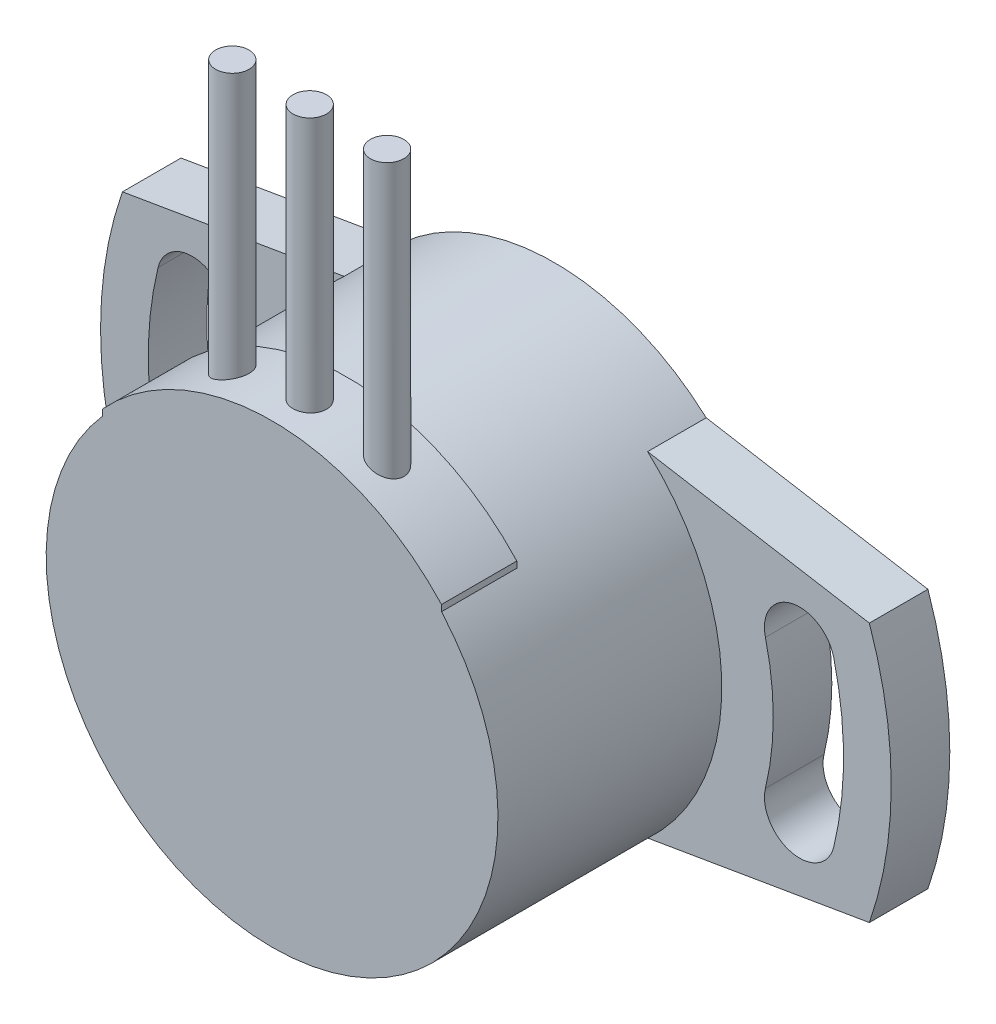
from build123d import *

# Parameters (mm, degrees)
SKETCH1_R           = 13.716
BOSS_EXTRUDE1_DEPTH = 13.589
BOSS_EXTRUDE2_START = 3.556
BOSS_EXTRUDE2_DEPTH = 3.556
CUT_EXTRUDE1_DEPTH  = 3.556
SKETCH4_R           = 4.953
BOSS_EXTRUDE3_DEPTH = 4.826
SKETCH5_R           = 3.01625
CUT_EXTRUDE2_DEPTH  = 2.54
BOSS_EXTRUDE4_DEPTH = 4.572
SKETCH6_R           = 1.016
BOSS_EXTRUDE5_DEPTH = 29.464


with BuildPart() as part:
    # Sketch1 → Boss-Extrude1 (new body)
    with BuildSketch(Plane.XY):
        Circle(SKETCH1_R)
    extrude(amount=BOSS_EXTRUDE1_DEPTH)

    # Sketch2 → Boss-Extrude2 (add)
    with BuildSketch(Plane(origin=(0, 0, 0), x_dir=(-1, 0, 0), z_dir=(0, 0, -1)).offset(BOSS_EXTRUDE2_START)):
        with BuildLine():
            Line((-9.214285431, 10.16), (-22.674746592, 7.874))
            ThreePointArc((-22.674746592, 7.874), (-24.003, 0), (-22.674746592, -7.874))
            Line((-22.674746592, -7.874), (-9.214285431, -10.16))
            ThreePointArc((-9.214285431, -10.16), (13.716, 0), (-9.214285431, 10.16))
        make_face()
    boss_extrude2 = extrude(amount=-BOSS_EXTRUDE2_DEPTH)

    # Sketch3 → Cut-Extrude1 (cut)
    with BuildSketch(Plane(origin=(0, 0, -3.556), x_dir=(-1, 0, 0), z_dir=(0, 0, -1))):
        with BuildLine():
            ThreePointArc((-16.365965281, -3.96831406), (-16.8402, 6.1e-08), (-16.365965252, 3.968314178))
            ThreePointArc((-16.365965252, 3.968314178), (-17.93670842, 6.544602887), (-20.512997182, 4.973859806))
            ThreePointArc((-20.512997182, 4.973859806), (-21.1074, 4.2e-08), (-20.512997202, -4.973859724))
            ThreePointArc((-20.512997202, -4.973859724), (-17.936708402, -6.544602882), (-16.365965281, -3.96831406))
        make_face()
    cut_extrude1 = extrude(amount=-CUT_EXTRUDE1_DEPTH, mode=Mode.SUBTRACT)

    # Mirror1: Boss-Extrude2, Cut-Extrude1 across plane
    add(boss_extrude2.mirror(Plane(origin=(0, 0, 0), x_dir=(0, 0, 1), z_dir=(1, 0, 0))))
    add(cut_extrude1.mirror(Plane(origin=(0, 0, 0), x_dir=(0, 0, 1), z_dir=(1, 0, 0))), mode=Mode.SUBTRACT)

    # Sketch4 → Boss-Extrude3 (add)
    with BuildSketch(Plane(origin=(0, 0, -3.556), x_dir=(-1, 0, 0), z_dir=(0, 0, -1))):
        Circle(SKETCH4_R)
    extrude(amount=BOSS_EXTRUDE3_DEPTH)

    # Sketch5 → Cut-Extrude2 (cut)
    with BuildSketch(Plane(origin=(0, 0, -8.382), x_dir=(-1, 0, 0), z_dir=(0, 0, -1))):
        Circle(SKETCH5_R)
    extrude(amount=-CUT_EXTRUDE2_DEPTH, mode=Mode.SUBTRACT)

    # Sketch7 → Boss-Extrude4 (add)
    with BuildSketch(Plane.XY.offset(13.589)):
        with BuildLine():
            ThreePointArc((10.287, 9.45190621), (0, 13.97), (-10.287, 9.45190621))
            Line((-10.287, 9.45190621), (-10.287, 5.951559827))
            Line((-10.287, 5.951559827), (10.287, 5.951559827))
            Line((10.287, 5.951559827), (10.287, 9.45190621))
        make_face()
    extrude(amount=-BOSS_EXTRUDE4_DEPTH)

    # Sketch6 → Boss-Extrude5 (add)
    with BuildSketch(Plane(origin=(0, 0, 0), x_dir=(1, 0, 0), z_dir=(0, 1, 0))):
        with Locations((0, -11.303)):
            Circle(SKETCH6_R)
        with Locations((-4.699, -11.303)):
            Circle(SKETCH6_R)
        with Locations((4.699, -11.303)):
            Circle(SKETCH6_R)
    extrude(amount=BOSS_EXTRUDE5_DEPTH)


solid = part.part
